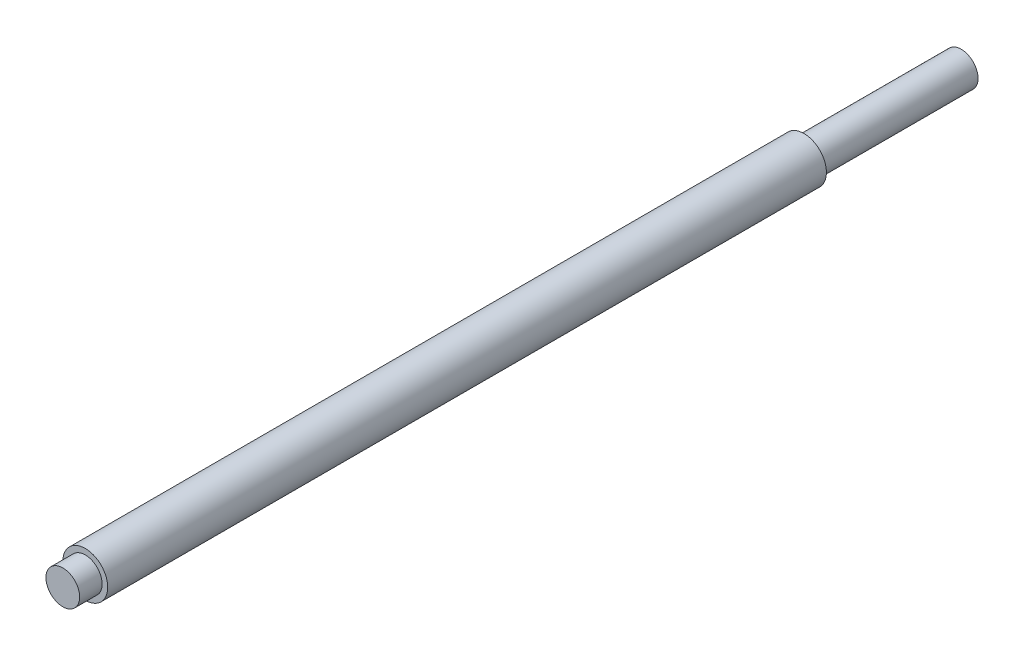
from build123d import *

# Parameters (mm, degrees)
SKETCH1_R           = 6.35
BOSS_EXTRUDE1_DEPTH = 254
SKETCH2_R           = 6.35
SKETCH2_R_2         = 4.7625
LONG_TRIM_DEPTH     = 44.45
CUT_EXTRUDE2_START  = -6.35
SKETCH3_R           = 6.35
SKETCH3_R_2         = 4.7625
CUT_EXTRUDE2_DEPTH  = 6.35


with BuildPart() as part:
    # Sketch1 → Boss-Extrude1 (new body)
    with BuildSketch(Plane.XY):
        Circle(SKETCH1_R)
    extrude(amount=BOSS_EXTRUDE1_DEPTH)

    # Sketch2 → long-trim (cut)
    with BuildSketch(Plane(origin=(0, 0, 0), x_dir=(-1, 0, 0), z_dir=(0, 0, -1))):
        Circle(SKETCH2_R)
        Circle(SKETCH2_R_2, mode=Mode.SUBTRACT)
    extrude(amount=-LONG_TRIM_DEPTH, mode=Mode.SUBTRACT)

    # Sketch3 → Cut-Extrude2 (cut)
    with BuildSketch(Plane.XY.offset(254).offset(CUT_EXTRUDE2_START)):
        Circle(SKETCH3_R)
        Circle(SKETCH3_R_2, mode=Mode.SUBTRACT)
    extrude(amount=CUT_EXTRUDE2_DEPTH, mode=Mode.SUBTRACT)


solid = part.part
